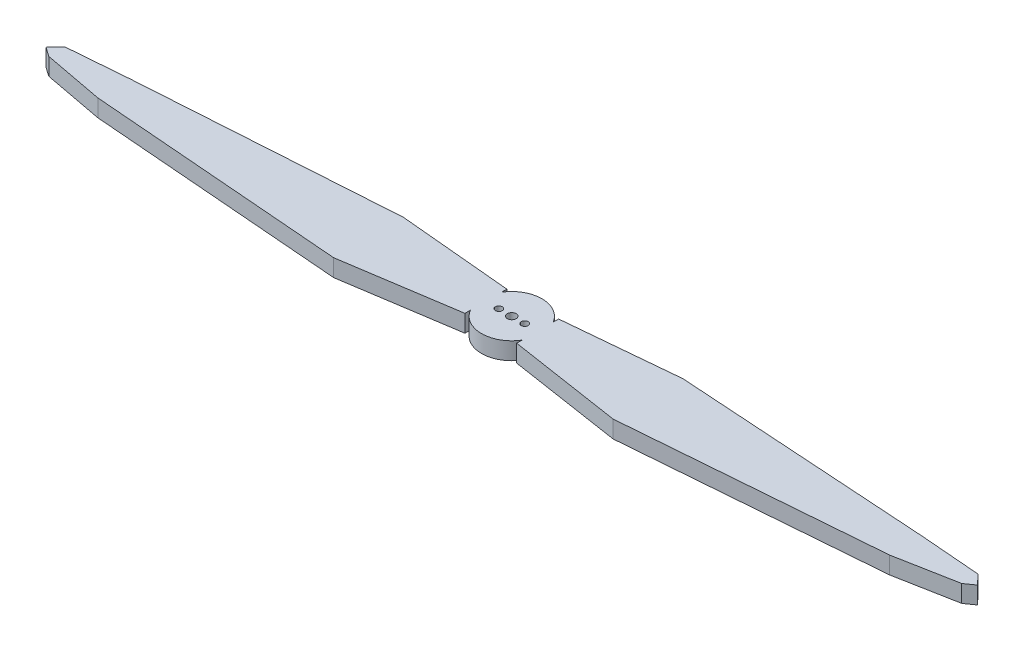
from build123d import *

# Parameters (mm, degrees)
BOSS_EXTRUDE1_DEPTH     = 8
BOSS_EXTRUDE1_2_DEPTH   = 8
SKETCH2_R               = 14
BOSS_EXTRUDE2_DEPTH     = 8
CUT_EXTRUDE1_DEPTH      = 217.781153328
CUT_EXTRUDE1_DEPTH_BACK = 217.781153328
SKETCH3_R               = 2.05
SKETCH3_R_2             = 1.6


with BuildPart() as part:
    # Sketch1 → Boss-Extrude1 (new body)
    with BuildSketch(Plane(origin=(0, 0, 0), x_dir=(1, 0, 0), z_dir=(0, 1, 0))):
        Polygon((12, -9.7155), (64.77, -17.81175), (183.515, -8.31215), (211.582, -3.0226), (215.9, 0), (211.582, 4.5339), (183.515, 6.80085), (64.77, 14.57325), (12, 9.7155), align=None)
    extrude(amount=BOSS_EXTRUDE1_DEPTH)



with BuildPart() as body_2:
    # Sketch1 → Boss-Extrude1 2 (new body)
    with BuildSketch(Plane(origin=(0, 0, 0), x_dir=(1, 0, 0), z_dir=(0, 1, 0))):
        Polygon((-12, -9.7155), (-64.77, -17.81175), (-183.515, -8.31215), (-211.582, -3.0226), (-215.9, 0), (-211.582, 4.5339), (-183.515, 6.80085), (-64.77, 14.57325), (-12, 9.7155), align=None)
    extrude(amount=BOSS_EXTRUDE1_2_DEPTH)


with BuildPart() as part_1:
    add(part.part)

    add(body_2.part)  # Boss-Extrude2 merges body 2
    # Sketch2 → Boss-Extrude2 (add)
    with BuildSketch(Plane(origin=(0, 0, 0), x_dir=(1, 0, 0), z_dir=(0, 1, 0))):
        Circle(SKETCH2_R)
    extrude(amount=BOSS_EXTRUDE2_DEPTH)

    # Sketch3 → Cut-Extrude1 (cut, two sides: drawn at the far end of the back side and taken through both)
    with BuildSketch(Plane(origin=(0, 0, 0), x_dir=(1, 0, 0), z_dir=(0, 1, 0)).offset(-CUT_EXTRUDE1_DEPTH_BACK)):
        Circle(SKETCH3_R)
        with Locations((6, 0)):
            Circle(SKETCH3_R_2)
        with Locations((-6, 0)):
            Circle(SKETCH3_R_2)
    extrude(amount=CUT_EXTRUDE1_DEPTH + CUT_EXTRUDE1_DEPTH_BACK, mode=Mode.SUBTRACT)


solid = part_1.part
